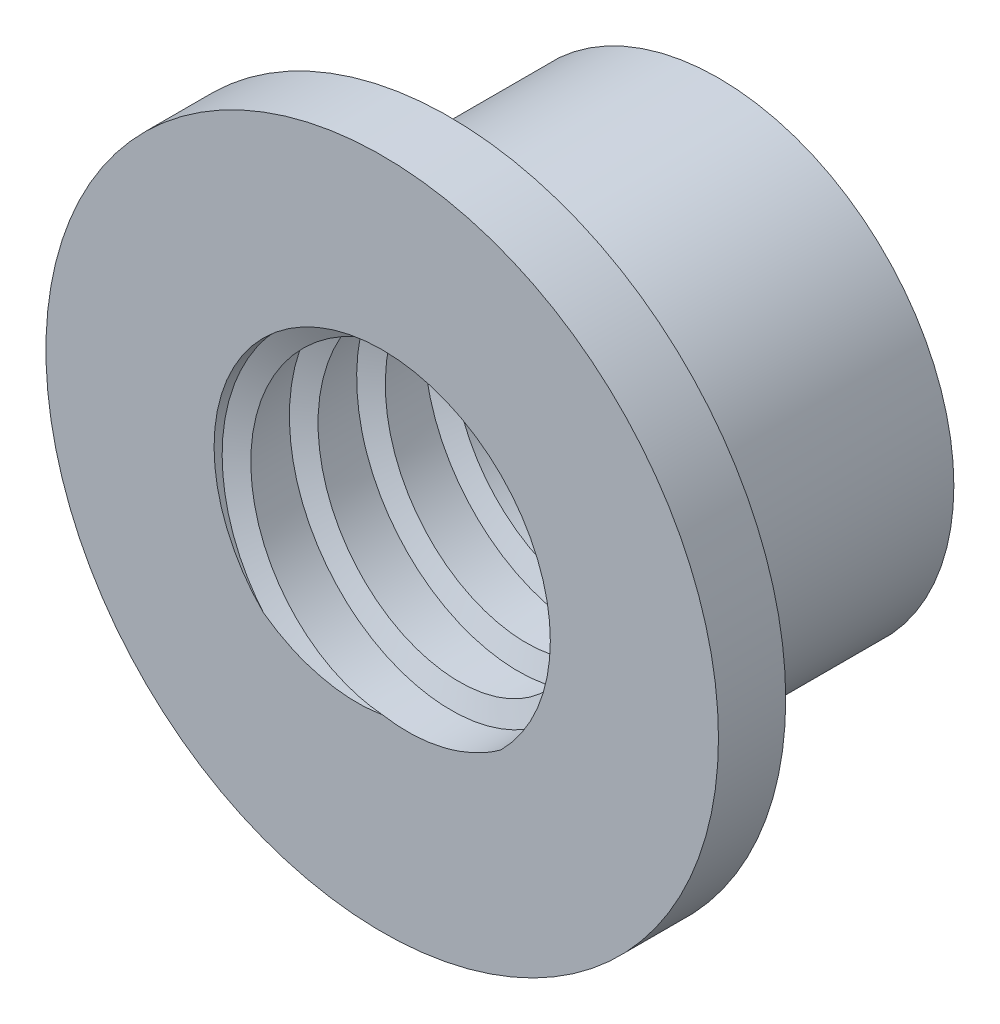
from build123d import *

# Parameters (mm, degrees)
SKETCH1_R           = 4
BOSS_EXTRUDE1_DEPTH = 5
SKETCH2_R           = 5
BOSS_EXTRUDE2_DEPTH = 35
SKETCH3_R           = 4
BOSS_EXTRUDE3_DEPTH = 5
SKETCH6_R           = 2.5
CUT_EXTRUDE1_DEPTH  = 10
CUT_SWEEP3_PITCH    = 2
PART4_START         = 60
PART4_OUTLINE_R     = 7
PART4_OUTLINE_R_2   = 4.25
PART4_DEPTH         = 10
PART4_START_2       = 68
PART4_2_OUTLINE_R   = 10
PART4_2_OUTLINE_R_2 = 7
PART4_2_DEPTH       = 2


with BuildPart() as part:
    # Sketch1 → Boss-Extrude1 (new body)
    with BuildSketch(Plane.XY):
        Circle(SKETCH1_R)
    extrude(amount=BOSS_EXTRUDE1_DEPTH)

    # Sketch2 → Boss-Extrude2 (add)
    with BuildSketch(Plane.XY.offset(5)):
        Circle(SKETCH2_R)
    boss_extrude2 = extrude(amount=BOSS_EXTRUDE2_DEPTH)

    # Mirror1: Boss-Extrude2 across plane
    add(boss_extrude2.mirror(Plane.XY.offset(40)))

    # Sketch3 → Boss-Extrude3 (add)
    with BuildSketch(Plane.XY.offset(75)):
        Circle(SKETCH3_R)
    extrude(amount=BOSS_EXTRUDE3_DEPTH)

    # Sketch6 → Cut-Extrude1 (cut)
    with BuildSketch(Plane.XY.offset(80)):
        Circle(SKETCH6_R)
    extrude(amount=-CUT_EXTRUDE1_DEPTH, mode=Mode.SUBTRACT)

    # Cut-Sweep3: arcs per turn and ends read off the stored shape
    # Cut-Sweep3: the profile of Sketch4 screwed along a right-hand helix through 36 turns, 10 arcs to a turn; built about Z, then put on its axis
    cut_sweep3_z = Axis((0, 0, 0), (0, 0, 1))
    cut_sweep3_corners = [(5, -8.73e-07, -0.500000056), (5, -8.73e-07, -0.750000056), (4.396446609, -7.67e-07, -0.500000056), (5, -8.73e-07, -0.250000056)]
    with BuildLine(mode=Mode.PRIVATE) as cut_sweep3_profile:
        Line(cut_sweep3_corners[0], cut_sweep3_corners[1])
        Line(cut_sweep3_corners[1], cut_sweep3_corners[2])
        Line(cut_sweep3_corners[2], cut_sweep3_corners[3])
        Line(cut_sweep3_corners[3], cut_sweep3_corners[0])
    cut_sweep3_cap = Face(cut_sweep3_profile.wire())
    cut_sweep3_turn_angles = [0, 18, 36, 54, 72, 90, 108, 126, 144, 162, 180, 198, 216, 234, 252, 270, 288, 306, 324, 342, 360]
    cut_sweep3_turn_weights = [1, 0.9510565162951535, 1, 0.9510565162951535, 1, 0.9510565162951535, 1, 0.9510565162951535, 1, 0.9510565162951535, 1, 0.9510565162951535, 1, 0.9510565162951535, 1, 0.9510565162951535, 1, 0.9510565162951535, 1, 0.9510565162951535, 1]
    cut_sweep3_turn_rails = [Edge.make_bspline([Vector(p[0], p[1], 0).rotate(cut_sweep3_z, cut_sweep3_turn_angles[k]) / cut_sweep3_turn_weights[k] + Vector(0, 0, p[2] + CUT_SWEEP3_PITCH * cut_sweep3_turn_angles[k] / 360) for k in range(21)], [0, 0, 0, 1, 1, 2, 2, 3, 3, 4, 4, 5, 5, 6, 6, 7, 7, 8, 8, 9, 9, 10, 10, 10], 2, cut_sweep3_turn_weights) for p in cut_sweep3_corners]
    cut_sweep3_turn_sides = [Face.make_surface_from_curves(cut_sweep3_turn_rails[p[0]], cut_sweep3_turn_rails[p[1]]) for p in [(0, 1), (1, 2), (2, 3), (3, 0)]]
    cut_sweep3 = Plane(origin=(0, 0, 5), x_dir=(1, 0, 0), z_dir=(0, 0, 1)) * Solid(Shell([*[p.moved(Location((0, 0, CUT_SWEEP3_PITCH * i))) for i in range(36) for p in cut_sweep3_turn_sides], cut_sweep3_cap, cut_sweep3_cap.rotate(cut_sweep3_z, 12960).moved(Location((0, 0, CUT_SWEEP3_PITCH * 12960 / 360)))]))
    add(cut_sweep3, mode=Mode.SUBTRACT)


with BuildPart() as body_2:
    # Part4: read off the stored shape, not the designer's step
    # Part4 outline → Part4 (new body)
    with BuildSketch(Plane.XY.offset(PART4_START)):
        Circle(PART4_OUTLINE_R)
        Circle(PART4_OUTLINE_R_2, mode=Mode.SUBTRACT)
    extrude(amount=PART4_DEPTH)

    # Part4 2 outline → Part4 2 (add)
    with BuildSketch(Plane.XY.offset(PART4_START_2)):
        Circle(PART4_2_OUTLINE_R)
        Circle(PART4_2_OUTLINE_R_2, mode=Mode.SUBTRACT)
    extrude(amount=PART4_2_DEPTH)

    # Combine2: cut part
    add(part.part, mode=Mode.SUBTRACT)


solid = body_2.part
